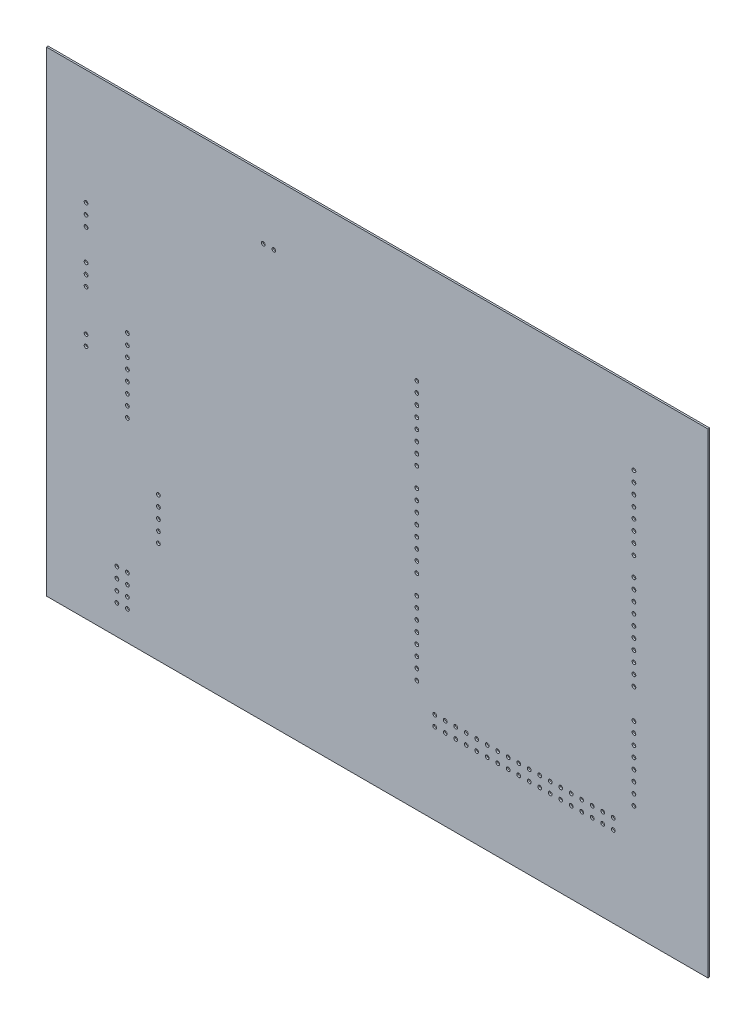
from build123d import *

# Parameters (mm, degrees)
SKETCH1_W                          = 160
SKETCH1_H                          = 115.000001
BOARD_DEPTH                        = 0.41148
F_1_0_228_DIAMETER_HOLE1_OUTLINE_R = 0.4500005
F_1_0_228_DIAMETER_HOLE1_DEPTH     = 0.41148


# Read off the part's stored shape, not the designer's step: #1 (0.228) Diameter Hole1
with BuildPart() as part:
    # Sketch1 → Board (new body)
    with BuildSketch(Plane.XY):
        with Locations((105.4, 82.9000005)):
            Rectangle(SKETCH1_W, SKETCH1_H)
    extrude(amount=BOARD_DEPTH)

    # #1 (0.228) Diameter Hole1 outline → #1 (0.228) Diameter Hole1 (cut)
    with BuildSketch(Plane.XY):
        with Locations((167.500003, 82.580002)):
            Circle(F_1_0_228_DIAMETER_HOLE1_OUTLINE_R)
        with Locations((167.500003, 100.360002)):
            Circle(F_1_0_228_DIAMETER_HOLE1_OUTLINE_R)
        with Locations((167.500003, 97.820002)):
            Circle(F_1_0_228_DIAMETER_HOLE1_OUTLINE_R)
        with Locations((167.500003, 95.280002)):
            Circle(F_1_0_228_DIAMETER_HOLE1_OUTLINE_R)
        with Locations((167.500003, 92.740002)):
            Circle(F_1_0_228_DIAMETER_HOLE1_OUTLINE_R)
        with Locations((167.500003, 90.200002)):
            Circle(F_1_0_228_DIAMETER_HOLE1_OUTLINE_R)
        with Locations((167.500003, 87.660002)):
            Circle(F_1_0_228_DIAMETER_HOLE1_OUTLINE_R)
        with Locations((167.500003, 85.120002)):
            Circle(F_1_0_228_DIAMETER_HOLE1_OUTLINE_R)
        with Locations((167.500003, 80.040002)):
            Circle(F_1_0_228_DIAMETER_HOLE1_OUTLINE_R)
        with Locations((167.500003, 77.500002)):
            Circle(F_1_0_228_DIAMETER_HOLE1_OUTLINE_R)
        with Locations((115.000001, 97.500003)):
            Circle(F_1_0_228_DIAMETER_HOLE1_OUTLINE_R)
        with Locations((115.000001, 100.040003)):
            Circle(F_1_0_228_DIAMETER_HOLE1_OUTLINE_R)
        with Locations((115.000001, 102.580003)):
            Circle(F_1_0_228_DIAMETER_HOLE1_OUTLINE_R)
        with Locations((115.000001, 105.120003)):
            Circle(F_1_0_228_DIAMETER_HOLE1_OUTLINE_R)
        with Locations((115.000001, 107.660003)):
            Circle(F_1_0_228_DIAMETER_HOLE1_OUTLINE_R)
        with Locations((115.000001, 110.200003)):
            Circle(F_1_0_228_DIAMETER_HOLE1_OUTLINE_R)
        with Locations((115.000001, 112.740003)):
            Circle(F_1_0_228_DIAMETER_HOLE1_OUTLINE_R)
        with Locations((115.000001, 115.280003)):
            Circle(F_1_0_228_DIAMETER_HOLE1_OUTLINE_R)
        with Locations((42.459999, 40.120001)):
            Circle(F_1_0_228_DIAMETER_HOLE1_OUTLINE_R)
        with Locations((42.459999, 37.580001)):
            Circle(F_1_0_228_DIAMETER_HOLE1_OUTLINE_R)
        with Locations((42.459999, 35.040001)):
            Circle(F_1_0_228_DIAMETER_HOLE1_OUTLINE_R)
        with Locations((42.459999, 32.500001)):
            Circle(F_1_0_228_DIAMETER_HOLE1_OUTLINE_R)
        with Locations((44.999999, 40.120001)):
            Circle(F_1_0_228_DIAMETER_HOLE1_OUTLINE_R)
        with Locations((44.999999, 37.580001)):
            Circle(F_1_0_228_DIAMETER_HOLE1_OUTLINE_R)
        with Locations((44.999999, 35.040001)):
            Circle(F_1_0_228_DIAMETER_HOLE1_OUTLINE_R)
        with Locations((44.999999, 32.500001)):
            Circle(F_1_0_228_DIAMETER_HOLE1_OUTLINE_R)
        with Locations((115.000001, 75.000002)):
            Circle(F_1_0_228_DIAMETER_HOLE1_OUTLINE_R)
        with Locations((115.000001, 77.540002)):
            Circle(F_1_0_228_DIAMETER_HOLE1_OUTLINE_R)
        with Locations((115.000001, 80.080002)):
            Circle(F_1_0_228_DIAMETER_HOLE1_OUTLINE_R)
        with Locations((115.000001, 82.620002)):
            Circle(F_1_0_228_DIAMETER_HOLE1_OUTLINE_R)
        with Locations((115.000001, 85.160002)):
            Circle(F_1_0_228_DIAMETER_HOLE1_OUTLINE_R)
        with Locations((115.000001, 87.700002)):
            Circle(F_1_0_228_DIAMETER_HOLE1_OUTLINE_R)
        with Locations((115.000001, 90.240002)):
            Circle(F_1_0_228_DIAMETER_HOLE1_OUTLINE_R)
        with Locations((115.000001, 92.780002)):
            Circle(F_1_0_228_DIAMETER_HOLE1_OUTLINE_R)
        with Locations((35.000001, 95)):
            Circle(F_1_0_228_DIAMETER_HOLE1_OUTLINE_R)
        with Locations((35.000001, 97.540001)):
            Circle(F_1_0_228_DIAMETER_HOLE1_OUTLINE_R)
        with Locations((35.000001, 100.08)):
            Circle(F_1_0_228_DIAMETER_HOLE1_OUTLINE_R)
        with Locations((167.500003, 105.000003)):
            Circle(F_1_0_228_DIAMETER_HOLE1_OUTLINE_R)
        with Locations((167.500003, 107.540003)):
            Circle(F_1_0_228_DIAMETER_HOLE1_OUTLINE_R)
        with Locations((167.500003, 110.080003)):
            Circle(F_1_0_228_DIAMETER_HOLE1_OUTLINE_R)
        with Locations((167.500003, 112.620003)):
            Circle(F_1_0_228_DIAMETER_HOLE1_OUTLINE_R)
        with Locations((167.500003, 115.160003)):
            Circle(F_1_0_228_DIAMETER_HOLE1_OUTLINE_R)
        with Locations((167.500003, 117.700003)):
            Circle(F_1_0_228_DIAMETER_HOLE1_OUTLINE_R)
        with Locations((167.500003, 120.240003)):
            Circle(F_1_0_228_DIAMETER_HOLE1_OUTLINE_R)
        with Locations((167.500003, 122.780003)):
            Circle(F_1_0_228_DIAMETER_HOLE1_OUTLINE_R)
        with Locations((35.000001, 107.500001)):
            Circle(F_1_0_228_DIAMETER_HOLE1_OUTLINE_R)
        with Locations((35.000001, 110.040001)):
            Circle(F_1_0_228_DIAMETER_HOLE1_OUTLINE_R)
        with Locations((35.000001, 112.580001)):
            Circle(F_1_0_228_DIAMETER_HOLE1_OUTLINE_R)
        with Locations((115.000001, 52.500002)):
            Circle(F_1_0_228_DIAMETER_HOLE1_OUTLINE_R)
        with Locations((115.000001, 55.040002)):
            Circle(F_1_0_228_DIAMETER_HOLE1_OUTLINE_R)
        with Locations((115.000001, 57.580002)):
            Circle(F_1_0_228_DIAMETER_HOLE1_OUTLINE_R)
        with Locations((115.000001, 60.120002)):
            Circle(F_1_0_228_DIAMETER_HOLE1_OUTLINE_R)
        with Locations((115.000001, 62.660002)):
            Circle(F_1_0_228_DIAMETER_HOLE1_OUTLINE_R)
        with Locations((115.000001, 65.200002)):
            Circle(F_1_0_228_DIAMETER_HOLE1_OUTLINE_R)
        with Locations((115.000001, 67.740002)):
            Circle(F_1_0_228_DIAMETER_HOLE1_OUTLINE_R)
        with Locations((115.000001, 70.280002)):
            Circle(F_1_0_228_DIAMETER_HOLE1_OUTLINE_R)
        with Locations((167.500003, 52.500002)):
            Circle(F_1_0_228_DIAMETER_HOLE1_OUTLINE_R)
        with Locations((167.500003, 55.040002)):
            Circle(F_1_0_228_DIAMETER_HOLE1_OUTLINE_R)
        with Locations((167.500003, 57.580002)):
            Circle(F_1_0_228_DIAMETER_HOLE1_OUTLINE_R)
        with Locations((167.500003, 60.120002)):
            Circle(F_1_0_228_DIAMETER_HOLE1_OUTLINE_R)
        with Locations((167.500003, 62.660002)):
            Circle(F_1_0_228_DIAMETER_HOLE1_OUTLINE_R)
        with Locations((167.500003, 65.200002)):
            Circle(F_1_0_228_DIAMETER_HOLE1_OUTLINE_R)
        with Locations((167.500003, 67.740002)):
            Circle(F_1_0_228_DIAMETER_HOLE1_OUTLINE_R)
        with Locations((167.500003, 70.280002)):
            Circle(F_1_0_228_DIAMETER_HOLE1_OUTLINE_R)
        with Locations((52.499999, 60.159999)):
            Circle(F_1_0_228_DIAMETER_HOLE1_OUTLINE_R)
        with Locations((52.499999, 57.619999)):
            Circle(F_1_0_228_DIAMETER_HOLE1_OUTLINE_R)
        with Locations((52.499999, 55.079999)):
            Circle(F_1_0_228_DIAMETER_HOLE1_OUTLINE_R)
        with Locations((52.499999, 52.539999)):
            Circle(F_1_0_228_DIAMETER_HOLE1_OUTLINE_R)
        with Locations((52.499999, 49.999999)):
            Circle(F_1_0_228_DIAMETER_HOLE1_OUTLINE_R)
        with Locations((35.000001, 82.5)):
            Circle(F_1_0_228_DIAMETER_HOLE1_OUTLINE_R)
        with Locations((35.000001, 85.04)):
            Circle(F_1_0_228_DIAMETER_HOLE1_OUTLINE_R)
        with Locations((119.32, 44.960002)):
            Circle(F_1_0_228_DIAMETER_HOLE1_OUTLINE_R)
        with Locations((119.32, 47.500002)):
            Circle(F_1_0_228_DIAMETER_HOLE1_OUTLINE_R)
        with Locations((121.86, 44.960002)):
            Circle(F_1_0_228_DIAMETER_HOLE1_OUTLINE_R)
        with Locations((121.86, 47.500002)):
            Circle(F_1_0_228_DIAMETER_HOLE1_OUTLINE_R)
        with Locations((124.4, 44.960002)):
            Circle(F_1_0_228_DIAMETER_HOLE1_OUTLINE_R)
        with Locations((124.4, 47.500002)):
            Circle(F_1_0_228_DIAMETER_HOLE1_OUTLINE_R)
        with Locations((126.94, 44.960002)):
            Circle(F_1_0_228_DIAMETER_HOLE1_OUTLINE_R)
        with Locations((126.94, 47.500002)):
            Circle(F_1_0_228_DIAMETER_HOLE1_OUTLINE_R)
        with Locations((129.48, 44.960002)):
            Circle(F_1_0_228_DIAMETER_HOLE1_OUTLINE_R)
        with Locations((129.48, 47.500002)):
            Circle(F_1_0_228_DIAMETER_HOLE1_OUTLINE_R)
        with Locations((132.02, 44.960002)):
            Circle(F_1_0_228_DIAMETER_HOLE1_OUTLINE_R)
        with Locations((132.02, 47.500002)):
            Circle(F_1_0_228_DIAMETER_HOLE1_OUTLINE_R)
        with Locations((134.56, 44.960002)):
            Circle(F_1_0_228_DIAMETER_HOLE1_OUTLINE_R)
        with Locations((134.56, 47.500002)):
            Circle(F_1_0_228_DIAMETER_HOLE1_OUTLINE_R)
        with Locations((137.1, 44.960002)):
            Circle(F_1_0_228_DIAMETER_HOLE1_OUTLINE_R)
        with Locations((137.1, 47.500002)):
            Circle(F_1_0_228_DIAMETER_HOLE1_OUTLINE_R)
        with Locations((139.64, 44.960002)):
            Circle(F_1_0_228_DIAMETER_HOLE1_OUTLINE_R)
        with Locations((139.64, 47.500002)):
            Circle(F_1_0_228_DIAMETER_HOLE1_OUTLINE_R)
        with Locations((142.18, 44.960002)):
            Circle(F_1_0_228_DIAMETER_HOLE1_OUTLINE_R)
        with Locations((142.18, 47.500002)):
            Circle(F_1_0_228_DIAMETER_HOLE1_OUTLINE_R)
        with Locations((144.72, 44.960002)):
            Circle(F_1_0_228_DIAMETER_HOLE1_OUTLINE_R)
        with Locations((144.72, 47.500002)):
            Circle(F_1_0_228_DIAMETER_HOLE1_OUTLINE_R)
        with Locations((147.26, 44.960002)):
            Circle(F_1_0_228_DIAMETER_HOLE1_OUTLINE_R)
        with Locations((147.26, 47.500002)):
            Circle(F_1_0_228_DIAMETER_HOLE1_OUTLINE_R)
        with Locations((149.8, 44.960002)):
            Circle(F_1_0_228_DIAMETER_HOLE1_OUTLINE_R)
        with Locations((149.8, 47.500002)):
            Circle(F_1_0_228_DIAMETER_HOLE1_OUTLINE_R)
        with Locations((152.34, 44.960002)):
            Circle(F_1_0_228_DIAMETER_HOLE1_OUTLINE_R)
        with Locations((152.34, 47.500002)):
            Circle(F_1_0_228_DIAMETER_HOLE1_OUTLINE_R)
        with Locations((154.88, 44.960002)):
            Circle(F_1_0_228_DIAMETER_HOLE1_OUTLINE_R)
        with Locations((154.88, 47.500002)):
            Circle(F_1_0_228_DIAMETER_HOLE1_OUTLINE_R)
        with Locations((157.42, 44.960002)):
            Circle(F_1_0_228_DIAMETER_HOLE1_OUTLINE_R)
        with Locations((157.42, 47.500002)):
            Circle(F_1_0_228_DIAMETER_HOLE1_OUTLINE_R)
        with Locations((159.96, 44.960002)):
            Circle(F_1_0_228_DIAMETER_HOLE1_OUTLINE_R)
        with Locations((159.96, 47.500002)):
            Circle(F_1_0_228_DIAMETER_HOLE1_OUTLINE_R)
        with Locations((162.5, 44.960002)):
            Circle(F_1_0_228_DIAMETER_HOLE1_OUTLINE_R)
        with Locations((162.5, 47.500002)):
            Circle(F_1_0_228_DIAMETER_HOLE1_OUTLINE_R)
        with Locations((80.399999, 125.400001)):
            Circle(F_1_0_228_DIAMETER_HOLE1_OUTLINE_R)
        with Locations((77.859999, 125.400001)):
            Circle(F_1_0_228_DIAMETER_HOLE1_OUTLINE_R)
        with Locations((44.999999, 72.5)):
            Circle(F_1_0_228_DIAMETER_HOLE1_OUTLINE_R)
        with Locations((44.999999, 75.04)):
            Circle(F_1_0_228_DIAMETER_HOLE1_OUTLINE_R)
        with Locations((44.999999, 77.58)):
            Circle(F_1_0_228_DIAMETER_HOLE1_OUTLINE_R)
        with Locations((44.999999, 80.12)):
            Circle(F_1_0_228_DIAMETER_HOLE1_OUTLINE_R)
        with Locations((44.999999, 82.66)):
            Circle(F_1_0_228_DIAMETER_HOLE1_OUTLINE_R)
        with Locations((44.999999, 85.2)):
            Circle(F_1_0_228_DIAMETER_HOLE1_OUTLINE_R)
        with Locations((44.999999, 87.74)):
            Circle(F_1_0_228_DIAMETER_HOLE1_OUTLINE_R)
        with Locations((44.999999, 90.28)):
            Circle(F_1_0_228_DIAMETER_HOLE1_OUTLINE_R)
    extrude(amount=F_1_0_228_DIAMETER_HOLE1_DEPTH, mode=Mode.SUBTRACT)


solid = part.part
